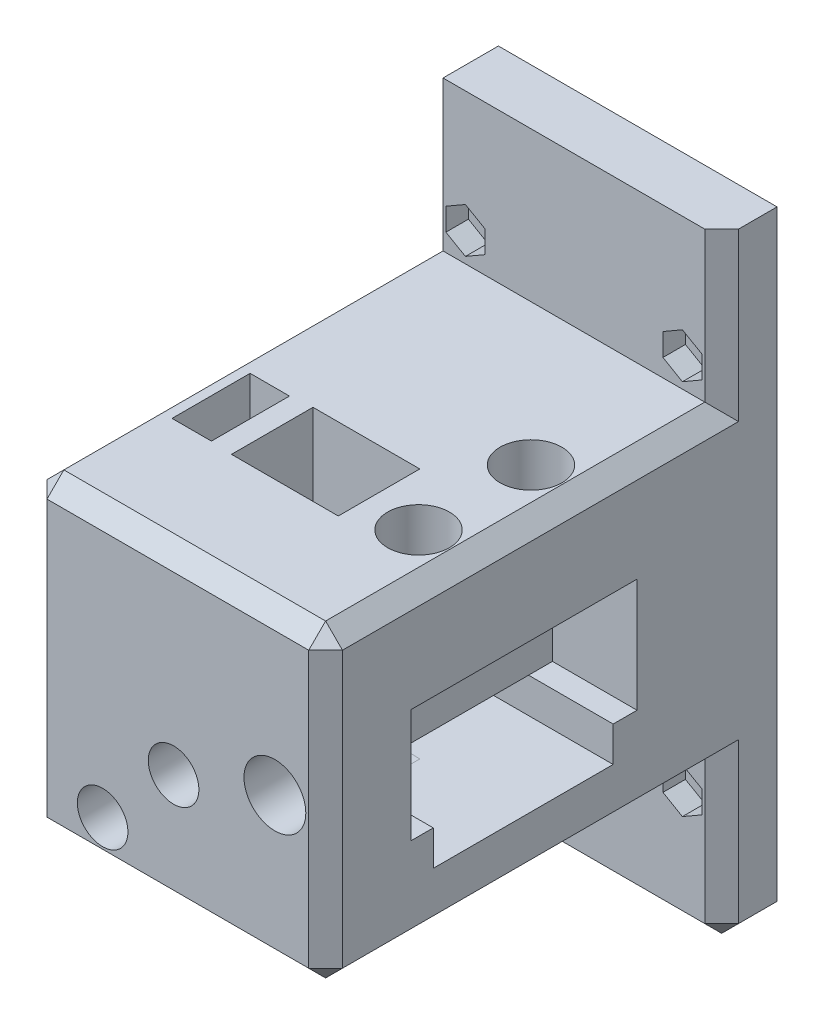
from build123d import *

# Parameters (mm, degrees)
SKETCH1_W                = 34.3
SKETCH1_H                = 70.3
SKETCH1_W_2              = 110
SKETCH1_H_2              = 9.85
BOSS_EXTRUDE1_DEPTH      = 15.048264774
BOSS_EXTRUDE3_DEPTH      = 10
BOSS_EXTRUDE4_DEPTH      = 27.518264774
CUT_EXTRUDE1_DEPTH       = 97.82308708
CUT_EXTRUDE1_DEPTH_BACK  = 97.82308708
SKETCH4_R                = 2
CUT_EXTRUDE3_DEPTH       = 77.2053469
CUT_EXTRUDE3_DEPTH_BACK  = 77.2053469
SKETCH8_W                = 129.903835659
SKETCH8_H                = 83.627886417
SKETCH9_W                = 44.357950904
SKETCH9_H                = 70.607950904
SKETCH9_W_2              = 20
SKETCH9_H_2              = 40
BOSS_EXTRUDE5_DEPTH      = 15.048264774
SKETCH10_W               = 20.2
SKETCH10_H               = 40.2
SKETCH10_W_2             = 20
SKETCH10_H_2             = 40
CUT_EXTRUDE6_DEPTH       = 81.359319258
SKETCH11_R               = 3
CUT_EXTRUDE7_DEPTH       = 30
CUT_EXTRUDE8_DEPTH       = 105.313703151
CUT_EXTRUDE8_DEPTH_BACK  = 8
SKETCH12_R               = 5.5
CUT_EXTRUDE10_DEPTH      = 81.359319258
CUT_EXTRUDE10_DEPTH_BACK = 81.359319258
SKETCH14_W               = 7.032197939
SKETCH14_H               = 32
SKETCH19_W               = 44.357950904
SKETCH19_H               = 70.453975452
BOSS_EXTRUDE9_DEPTH      = 3
BOSS_EXTRUDE6_DEPTH      = 19.3
SKETCH16_R               = 3.4
BOSS_EXTRUDE7_DEPTH      = 2.1
BOSS_EXTRUDE8_DEPTH      = 16.35
SKETCH20_R               = 3.4
BOSS_EXTRUDE10_DEPTH     = 0.5
SKETCH21_W               = 18.048264774
SKETCH21_H               = 5.321024548
BOSS_EXTRUDE11_DEPTH     = 14.5
BOSS_EXTRUDE12_START     = 0.5
SKETCH24_R               = 3.4
BOSS_EXTRUDE12_DEPTH     = 0.5
CUT_EXTRUDE11_START      = -0.25
SKETCH25_R               = 3.4
CUT_EXTRUDE11_DEPTH      = 0.25
SKETCH26_R               = 3.4
BOSS_EXTRUDE13_DEPTH     = 1
BOSS_EXTRUDE14_DEPTH     = 20.303975452
CUT_EXTRUDE12_DEPTH      = 4
SKETCH29_R               = 5.5
CUT_EXTRUDE13_DEPTH      = 8
SKETCH30_R               = 3
CUT_EXTRUDE14_DEPTH      = 26
CUT_EXTRUDE15_DEPTH      = 626.267941866
CUT_EXTRUDE15_DEPTH_BACK = 626.267941866
SKETCH31_W               = 192.459482296
SKETCH31_H               = 197.325031006
SKETCH31_W_2             = 7.003218593
SKETCH31_H_2             = 13.886852379
CUT_EXTRUDE16_DEPTH      = 626.668982681
CUT_EXTRUDE16_DEPTH_BACK = 626.668982681
SKETCH32_R               = 2.5
CUT_EXTRUDE17_DEPTH      = 626.668982681
CUT_EXTRUDE17_DEPTH_BACK = 16
SKETCH33_R               = 4.5
SKETCH34_R               = 4.5
CUT_EXTRUDE18_DEPTH      = 12
CUT_EXTRUDE19_DEPTH      = 20
CUT_EXTRUDE20_DEPTH      = 13


with BuildPart() as part:
    # Sketch1 → Boss-Extrude1 (new body)
    # profile 1 of 2: a face of its own
    with BuildSketch(Plane.YZ):
        Rectangle(SKETCH1_W, SKETCH1_H)
        with BuildLine():
            Line((-10.15, 6.7), (-10.15, -6.7))
            ThreePointArc((-10.15, -6.7), (-9.871751442, -7.371751442), (-9.2, -7.65))
            Line((-9.2, -7.65), (-8.5, -7.65))
            ThreePointArc((-8.5, -7.65), (-8.181801948, -7.518198052), (-8.05, -7.2))
            Line((-8.05, -7.2), (-8.05, -5.094911614))
            ThreePointArc((-8.05, -5.094911614), (-7.621019548, -4.452896997), (-6.863711672, -4.603534899))
            Line((-6.863711672, -4.603534899), (-4.684745674, -6.782500897))
            ThreePointArc((-4.684745674, -6.782500897), (-4.066943332, -7.707107441), (-3.85, -8.797755224))
            Line((-3.85, -8.797755224), (-3.85, -11.202244776))
            ThreePointArc((-3.85, -11.202244776), (-4.066943332, -12.292892559), (-4.684745674, -13.217499103))
            Line((-4.684745674, -13.217499103), (-6.863711672, -15.396465101))
            ThreePointArc((-6.863711672, -15.396465101), (-7.621019548, -15.547103003), (-8.05, -14.905088386))
            Line((-8.05, -14.905088386), (-8.05, -12.8))
            ThreePointArc((-8.05, -12.8), (-8.181801948, -12.481801948), (-8.5, -12.35))
            Line((-8.5, -12.35), (-9.2, -12.35))
            ThreePointArc((-9.2, -12.35), (-9.871751442, -12.628248558), (-10.15, -13.3))
            Line((-10.15, -13.3), (-10.15, -18))
            ThreePointArc((-10.15, -18), (-9.52027958, -19.52027958), (-8, -20.15))
            Line((-8, -20.15), (-3.3, -20.15))
            ThreePointArc((-3.3, -20.15), (-2.628248558, -19.871751442), (-2.35, -19.2))
            Line((-2.35, -19.2), (-2.35, -18.5))
            ThreePointArc((-2.35, -18.5), (-2.481801948, -18.181801948), (-2.8, -18.05))
            Line((-2.8, -18.05), (-4.905088386, -18.05))
            ThreePointArc((-4.905088386, -18.05), (-5.547103003, -17.621019548), (-5.396465101, -16.863711672))
            Line((-5.396465101, -16.863711672), (-3.217499103, -14.684745674))
            ThreePointArc((-3.217499103, -14.684745674), (-2.292892559, -14.066943332), (-1.202244776, -13.85))
            Line((-1.202244776, -13.85), (1.202244776, -13.85))
            ThreePointArc((1.202244776, -13.85), (2.292892559, -14.066943332), (3.217499103, -14.684745674))
            Line((3.217499103, -14.684745674), (5.396465101, -16.863711672))
            ThreePointArc((5.396465101, -16.863711672), (5.547103003, -17.621019548), (4.905088386, -18.05))
            Line((4.905088386, -18.05), (2.8, -18.05))
            ThreePointArc((2.8, -18.05), (2.481801948, -18.181801948), (2.35, -18.5))
            Line((2.35, -18.5), (2.35, -19.2))
            ThreePointArc((2.35, -19.2), (2.628248558, -19.871751442), (3.3, -20.15))
            Line((3.3, -20.15), (8, -20.15))
            ThreePointArc((8, -20.15), (9.52027958, -19.52027958), (10.15, -18))
            Line((10.15, -18), (10.15, -13.3))
            ThreePointArc((10.15, -13.3), (9.871751442, -12.628248558), (9.2, -12.35))
            Line((9.2, -12.35), (8.5, -12.35))
            ThreePointArc((8.5, -12.35), (8.181801948, -12.481801948), (8.05, -12.8))
            Line((8.05, -12.8), (8.05, -14.905088386))
            ThreePointArc((8.05, -14.905088386), (7.621019548, -15.547103003), (6.863711672, -15.396465101))
            Line((6.863711672, -15.396465101), (4.684745674, -13.217499103))
            ThreePointArc((4.684745674, -13.217499103), (4.066943332, -12.292892559), (3.85, -11.202244776))
            Line((3.85, -11.202244776), (3.85, -8.797755224))
            ThreePointArc((3.85, -8.797755224), (4.066943332, -7.707107441), (4.684745674, -6.782500897))
            Line((4.684745674, -6.782500897), (6.863711672, -4.603534899))
            ThreePointArc((6.863711672, -4.603534899), (7.621019548, -4.452896997), (8.05, -5.094911614))
            Line((8.05, -5.094911614), (8.05, -7.2))
            ThreePointArc((8.05, -7.2), (8.181801948, -7.518198052), (8.5, -7.65))
            Line((8.5, -7.65), (9.2, -7.65))
            ThreePointArc((9.2, -7.65), (9.871751442, -7.371751442), (10.15, -6.7))
            Line((10.15, -6.7), (10.15, 6.7))
            ThreePointArc((10.15, 6.7), (9.871751442, 7.371751442), (9.2, 7.65))
            Line((9.2, 7.65), (8.5, 7.65))
            ThreePointArc((8.5, 7.65), (8.181801948, 7.518198052), (8.05, 7.2))
            Line((8.05, 7.2), (8.05, 5.094911614))
            ThreePointArc((8.05, 5.094911614), (7.621019548, 4.452896997), (6.863711672, 4.603534899))
            Line((6.863711672, 4.603534899), (4.684745674, 6.782500897))
            ThreePointArc((4.684745674, 6.782500897), (4.066943332, 7.707107441), (3.85, 8.797755224))
            Line((3.85, 8.797755224), (3.85, 11.202244776))
            ThreePointArc((3.85, 11.202244776), (4.066943332, 12.292892559), (4.684745674, 13.217499103))
            Line((4.684745674, 13.217499103), (6.863711672, 15.396465101))
            ThreePointArc((6.863711672, 15.396465101), (7.621019548, 15.547103003), (8.05, 14.905088386))
            Line((8.05, 14.905088386), (8.05, 12.8))
            ThreePointArc((8.05, 12.8), (8.181801948, 12.481801948), (8.5, 12.35))
            Line((8.5, 12.35), (9.2, 12.35))
            ThreePointArc((9.2, 12.35), (9.871751442, 12.628248558), (10.15, 13.3))
            Line((10.15, 13.3), (10.15, 18))
            ThreePointArc((10.15, 18), (9.52027958, 19.52027958), (8, 20.15))
            Line((8, 20.15), (3.3, 20.15))
            ThreePointArc((3.3, 20.15), (2.628248558, 19.871751442), (2.35, 19.2))
            Line((2.35, 19.2), (2.35, 18.5))
            ThreePointArc((2.35, 18.5), (2.481801948, 18.181801948), (2.8, 18.05))
            Line((2.8, 18.05), (4.905088386, 18.05))
            ThreePointArc((4.905088386, 18.05), (5.547103003, 17.621019548), (5.396465101, 16.863711672))
            Line((5.396465101, 16.863711672), (3.217499103, 14.684745674))
            ThreePointArc((3.217499103, 14.684745674), (2.292892559, 14.066943332), (1.202244776, 13.85))
            Line((1.202244776, 13.85), (-1.202244776, 13.85))
            ThreePointArc((-1.202244776, 13.85), (-2.292892559, 14.066943332), (-3.217499103, 14.684745674))
            Line((-3.217499103, 14.684745674), (-5.396465101, 16.863711672))
            ThreePointArc((-5.396465101, 16.863711672), (-5.547103003, 17.621019548), (-4.905088386, 18.05))
            Line((-4.905088386, 18.05), (-2.8, 18.05))
            ThreePointArc((-2.8, 18.05), (-2.481801948, 18.181801948), (-2.35, 18.5))
            Line((-2.35, 18.5), (-2.35, 19.2))
            ThreePointArc((-2.35, 19.2), (-2.628248558, 19.871751442), (-3.3, 20.15))
            Line((-3.3, 20.15), (-8, 20.15))
            ThreePointArc((-8, 20.15), (-9.52027958, 19.52027958), (-10.15, 18))
            Line((-10.15, 18), (-10.15, 13.3))
            ThreePointArc((-10.15, 13.3), (-9.871751442, 12.628248558), (-9.2, 12.35))
            Line((-9.2, 12.35), (-8.5, 12.35))
            ThreePointArc((-8.5, 12.35), (-8.181801948, 12.481801948), (-8.05, 12.8))
            Line((-8.05, 12.8), (-8.05, 14.905088386))
            ThreePointArc((-8.05, 14.905088386), (-7.621019548, 15.547103003), (-6.863711672, 15.396465101))
            Line((-6.863711672, 15.396465101), (-4.684745674, 13.217499103))
            ThreePointArc((-4.684745674, 13.217499103), (-4.066943332, 12.292892559), (-3.85, 11.202244776))
            Line((-3.85, 11.202244776), (-3.85, 8.797755224))
            ThreePointArc((-3.85, 8.797755224), (-4.066943332, 7.707107441), (-4.684745674, 6.782500897))
            Line((-4.684745674, 6.782500897), (-6.863711672, 4.603534899))
            ThreePointArc((-6.863711672, 4.603534899), (-7.621019548, 4.452896997), (-8.05, 5.094911614))
            Line((-8.05, 5.094911614), (-8.05, 7.2))
            ThreePointArc((-8.05, 7.2), (-8.181801948, 7.518198052), (-8.5, 7.65))
            Line((-8.5, 7.65), (-9.2, 7.65))
            ThreePointArc((-9.2, 7.65), (-9.871751442, 7.371751442), (-10.15, 6.7))
        make_face(mode=Mode.SUBTRACT)
    # profile 2 of 2: a face of its own
    with BuildSketch(Plane.YZ):
        with Locations((0, -40.075)):
            Rectangle(SKETCH1_W_2, SKETCH1_H_2)
    extrude(amount=-BOSS_EXTRUDE1_DEPTH)

    # Sketch2 → Boss-Extrude3 (add)
    with BuildSketch(Plane.YZ):
        Polygon((17.15, 35.15), (-17.15, 35.15), (-17.15, -35.15), (-55, -35.15), (-55, -45), (55, -45), (55, -35.15), (17.15, -35.15), align=None)
    extrude(amount=BOSS_EXTRUDE3_DEPTH)

    # Sketch3 → Boss-Extrude4 (add)
    with BuildSketch(Plane.YZ.offset(10)):
        Polygon((-17.15, -35.15), (17.15, -35.15), (55, -35.15), (55, -45), (-55, -45), (-55, -35.15), align=None)
    extrude(amount=BOSS_EXTRUDE4_DEPTH)

    # Sketch4 → Cut-Extrude1 (cut, two sides: drawn at the far end of the back side and taken through both)
    with BuildSketch(Plane.XY.offset(-35.15).offset(-CUT_EXTRUDE1_DEPTH_BACK)):
        with Locations((-8.06818722, 33.5)):
            Circle(SKETCH4_R)
        with Locations((-8.06818722, -33.5)):
            Circle(SKETCH4_R)
        with Locations((30.53818722, -33.5)):
            Circle(SKETCH4_R)
        with Locations((30.53818722, 33.5)):
            Circle(SKETCH4_R)
    extrude(amount=CUT_EXTRUDE1_DEPTH + CUT_EXTRUDE1_DEPTH_BACK, mode=Mode.SUBTRACT)

    # Sketch8 → Cut-Extrude3 (cut, two sides: drawn at the far end of the back side and taken through both)
    with BuildSketch(Plane.YZ.offset(10).offset(-CUT_EXTRUDE3_DEPTH_BACK)):
        with Locations((-9.95191783, 6.663943208)):
            Rectangle(SKETCH8_W, SKETCH8_H)
    extrude(amount=CUT_EXTRUDE3_DEPTH + CUT_EXTRUDE3_DEPTH_BACK, mode=Mode.SUBTRACT)

    # Sketch9 → Boss-Extrude5 (add)
    with BuildSketch(Plane(origin=(-15.048264774, 0, 0), x_dir=(0, -1, 0), z_dir=(-1, 0, 0))):
        with Locations((-0.848975452, 0)):
            Rectangle(SKETCH9_W, SKETCH9_H)
        Rectangle(SKETCH9_W_2, SKETCH9_H_2, mode=Mode.SUBTRACT)
    extrude(amount=-BOSS_EXTRUDE5_DEPTH)

    # Sketch10 → Cut-Extrude6 (cut, through all)
    with BuildSketch(Plane.YZ):
        Rectangle(SKETCH10_W, SKETCH10_H)
        Rectangle(SKETCH10_W_2, SKETCH10_H_2, mode=Mode.SUBTRACT)
    extrude(amount=-CUT_EXTRUDE6_DEPTH, mode=Mode.SUBTRACT)

    # Sketch11 → Cut-Extrude7 (cut)
    with BuildSketch(Plane.XY.offset(35.303975452)):
        with Locations((-6.024132387, 0)):
            Circle(SKETCH11_R)
    extrude(amount=-CUT_EXTRUDE7_DEPTH, mode=Mode.SUBTRACT)

    # Sketch12 → Cut-Extrude8 (cut, two sides: drawn at the far end of the back side and taken through both)
    with BuildSketch(Plane.XY.offset(35.303975452).offset(-CUT_EXTRUDE8_DEPTH_BACK)):
        with Locations((-6.024132387, 0)):
            Circle(SKETCH12_R)
    extrude(amount=CUT_EXTRUDE8_DEPTH + CUT_EXTRUDE8_DEPTH_BACK, mode=Mode.SUBTRACT)

    # Sketch14 → Cut-Extrude10 (cut, two sides: drawn at the far end of the back side and taken through both)
    with BuildSketch(Plane.YZ.offset(-CUT_EXTRUDE10_DEPTH_BACK)):
        with Locations((-12.813901031, 0.15)):
            Rectangle(SKETCH14_W, SKETCH14_H)
    extrude(amount=CUT_EXTRUDE10_DEPTH + CUT_EXTRUDE10_DEPTH_BACK, mode=Mode.SUBTRACT)

    # Sketch19 → Boss-Extrude9 (add)
    # profile 1 of 2: a face of its own
    with BuildSketch(Plane.YZ):
        with Locations((0.848975452, 0.076987726)):
            Rectangle(SKETCH19_W, SKETCH19_H)
        Polygon((-16.33, -15.85), (-16.33, 16.15), (-10.1, 16.15), (-10.1, 20.1), (10.1, 20.1), (10.1, -20.1), (-10.1, -20.1), (-10.1, -15.85), align=None, mode=Mode.SUBTRACT)
    # profile 2 of 2: a face of its own
    with BuildSketch(Plane.YZ):
        Polygon((-10.1, 16.15), (-10.1, -15.85), (-10.1, -20.1), (10.1, -20.1), (10.1, 20.1), (-10.1, 20.1), align=None)
    extrude(amount=BOSS_EXTRUDE9_DEPTH)

    # Sketch15 → Boss-Extrude6 (add)
    with BuildSketch(Plane.XY.offset(-35.15)):
        Polygon((37.518264774, 28.348975452), (-15.048264774, 28.348975452), (-15.048264774, 23.027950904), (3, 23.027950904), (3, -21.33), (-15.048264774, -21.33), (-15.048264774, -26.651024548), (37.518264774, -26.651024548), align=None)
    extrude(amount=BOSS_EXTRUDE6_DEPTH)

    # Sketch16 → Boss-Extrude7 (add)
    with BuildSketch(Plane.XY.offset(-15.85)):
        with Locations(Location((24.73, -18.73, 0), (0, 0, 180))):
            Circle(SKETCH16_R)
    extrude(amount=BOSS_EXTRUDE7_DEPTH)

    # Sketch18 → Boss-Extrude8 (add)
    with BuildSketch(Plane.XY.offset(-15.85)):
        Polygon((14.73, -16.33), (3, -16.33), (3, -21.33), (-15.048264774, -21.33), (-15.048264774, -26.651024548), (14.73, -26.651024548), (14.73, -18.73), align=None)
        with BuildLine():
            Line((3, 23.027950904), (3, -10.1))
            Line((3, -10.1), (24.091429665, -8.750409431))
            ThreePointArc((24.091429665, -8.750409431), (31.571574988, -11.43665703), (34.73, -18.73))
            Line((34.73, -18.73), (34.73, -26.651024548))
            Line((34.73, -26.651024548), (37.518264774, -26.651024548))
            Line((37.518264774, -26.651024548), (37.518264774, 28.348975452))
            Line((37.518264774, 28.348975452), (-15.048264774, 28.348975452))
            Line((-15.048264774, 28.348975452), (-15.048264774, 23.027950904))
            Line((-15.048264774, 23.027950904), (3, 23.027950904))
        make_face()
    extrude(amount=BOSS_EXTRUDE8_DEPTH)

    # Sketch20 → Boss-Extrude10 (add)
    with BuildSketch(Plane.XY.offset(0.5)):
        with Locations((12, -6)):
            Circle(SKETCH20_R)
    extrude(amount=BOSS_EXTRUDE10_DEPTH)

    # Sketch21 → Boss-Extrude11 (add)
    with BuildSketch(Plane.XY.offset(0.5)):
        with BuildLine():
            Line((22, 28.348975452), (22, -6))
            ThreePointArc((22, -6), (19.071067812, -13.071067812), (12, -16))
            Line((12, -16), (3, -16.33))
            Line((3, -16.33), (3, -21.33))
            Line((3, -21.33), (-15.048264774, -21.33))
            Line((-15.048264774, -21.33), (-15.048264774, -26.651024548))
            Line((-15.048264774, -26.651024548), (37.518264774, -26.651024548))
            Line((37.518264774, -26.651024548), (37.518264774, 28.348975452))
            Line((37.518264774, 28.348975452), (22, 28.348975452))
        make_face()
        with Locations((-6.024132387, 25.688463178)):
            Rectangle(SKETCH21_W, SKETCH21_H)
    extrude(amount=BOSS_EXTRUDE11_DEPTH)

    # Sketch24 → Boss-Extrude12 (add)
    with BuildSketch(Plane.YX.offset(-0.5).offset(BOSS_EXTRUDE12_START)):
        with Locations(Location((-18.73, 24.73, 0), (0, 0, 270))):
            Circle(SKETCH24_R)
    extrude(amount=-BOSS_EXTRUDE12_DEPTH)

    # Sketch25 → Cut-Extrude11 (cut)
    with BuildSketch(Plane.XY.offset(-13.75).offset(CUT_EXTRUDE11_START)):
        with Locations(Location((24.73, -18.73, 0), (0, 0, 180))):
            Circle(SKETCH25_R)
    extrude(amount=CUT_EXTRUDE11_DEPTH, mode=Mode.SUBTRACT)



with BuildPart() as body_2:
    # Sketch26 → Boss-Extrude13 (new body)
    with BuildSketch(Plane(origin=(0, 0, 14), x_dir=(0, -1, 0), z_dir=(0, 0, 1))):
        with Locations(Location((6, 12, 0), (0, 0, 90))):
            Circle(SKETCH26_R)
    extrude(amount=BOSS_EXTRUDE13_DEPTH)


with BuildPart() as part_1:
    add(part.part)

    add(body_2.part)  # Boss-Extrude14 merges body 2
    # Sketch27 → Boss-Extrude14 (add)
    with BuildSketch(Plane.XY.offset(15)):
        with BuildLine():
            Line((3, -16.33), (3, -21.33))
            Line((3, -21.33), (-15.048264774, -21.33))
            Line((-15.048264774, -21.33), (-15.048264774, -26.651024548))
            Line((-15.048264774, -26.651024548), (37.518264774, -26.651024548))
            Line((37.518264774, -26.651024548), (37.518264774, 28.348975452))
            Line((37.518264774, 28.348975452), (22, 28.348975452))
            Line((22, 28.348975452), (22, -6))
            ThreePointArc((22, -6), (19.071067812, -13.071067812), (12, -16))
            Line((12, -16), (3, -16.33))
        make_face()
        with BuildLine():
            Line((-15.048264774, 28.348975452), (-15.048264774, 23.027950904))
            Line((-15.048264774, 23.027950904), (3, 23.027950904))
            Line((3, 23.027950904), (3, -16.33))
            Line((3, -16.33), (12, -16))
            ThreePointArc((12, -16), (19.071067812, -13.071067812), (22, -6))
            Line((22, -6), (22, 28.348975452))
            Line((22, 28.348975452), (-15.048264774, 28.348975452))
        make_face()
    extrude(amount=BOSS_EXTRUDE14_DEPTH)

    # Chamfer1
    # the kernel refuses this chamfer: 3 mm, written as the material it takes off along each edge
    with BuildSketch(Plane(origin=(-13.048264774, 26.348975452, 33.303975452), x_dir=(0.7071067812061043, 0.7071067811669909, 0), z_dir=(-0.5773502691639131, 0.577350269195849, 0.5773502692091153)), Plane(origin=(35.518264774, 26.348975452, 33.303975452), x_dir=(0.707106781206494, -0.707106781166601, 0), z_dir=(0.5773502691634868, 0.5773502691960591, 0.5773502692093315)), Plane(origin=(-13.048264774, -24.651024548, 33.303975452), x_dir=(0.707106781214228, 0, 0.7071067811588669), z_dir=(-0.5773502691639134, -0.5773502691958485, 0.5773502692091155))) as chamfer1_piece_1:
        Polygon((-2.121320344, 1.224744871), (2.121320344, 1.224744871), (0, -2.449489743), align=None)
    extrude(amount=3.810511777, mode=Mode.SUBTRACT)
    with BuildSketch(Plane(origin=(35.518264774, -24.651024548, 33.303975452), x_dir=(-0.7071067812146217, 0, 0.7071067811584735), z_dir=(0.5773502691634872, -0.5773502691960583, 0.577350269209332)), Plane(origin=(-13.048264774, -53, -37.15), x_dir=(0.7071067811865476, -0.7071067811865476, 0), z_dir=(-0.5773502691896262, -0.5773502691896262, 0.5773502691896248)), Plane(origin=(35.518264774, -53, -37.15), x_dir=(0, -0.7071067811865467, -0.7071067811865483), z_dir=(0.5773502691896262, -0.5773502691896262, 0.5773502691896248))) as chamfer1_piece_2:
        Polygon((-2.121320344, -1.224744871), (2.121320344, -1.224744871), (0, 2.449489743), align=None)
    extrude(amount=3.810511777, mode=Mode.SUBTRACT)
    with BuildSketch(Plane(origin=(-15.048264774, 28.348975452, -35.15), x_dir=(-0.02749587661058619, 0, -0.9996219169112968), z_dir=(0, 1, 0))) as chamfer1_piece_3:
        with BuildLine():
            Line((3.086019586, 0), (-0.169641465, -3.081353381))
            Line((-0.169641465, -3.081353381), (-0.22961878, -3.079703628))
            ThreePointArc((-0.22961878, -3.079703628), (-0.102387681, -1.540193489), (-0.059977315, 0.001649753))
            Line((-0.059977315, 0.001649753), (0.001649753, 0.059977315))
            ThreePointArc((0.001649753, 0.059977315), (1.543492994, 0.017566949), (3.087669338, 0.059977315))
            Line((3.087669338, 0.059977315), (3.086019586, 0))
        make_face()
    extrude(amount=34.366073512, mode=Mode.SUBTRACT)
    with BuildSketch(Plane(origin=(37.518264774, 28.348975452, -35.15), x_dir=(0.027495876610586768, 0, -0.9996219169112968), z_dir=(0, 1, 0))) as chamfer1_piece_4:
        with BuildLine():
            Line((3.086019586, 0), (-0.169641465, 3.081353381))
            Line((-0.169641465, 3.081353381), (-0.22961878, 3.079703628))
            ThreePointArc((-0.22961878, 3.079703628), (-0.102387681, 1.540193489), (-0.059977315, -0.001649753))
            Line((-0.059977315, -0.001649753), (0.001649753, -0.059977315))
            ThreePointArc((0.001649753, -0.059977315), (1.543492994, -0.017566949), (3.087669338, -0.059977315))
            Line((3.087669338, -0.059977315), (3.086019586, 0))
        make_face()
    extrude(amount=34.366073512, mode=Mode.SUBTRACT)
    with BuildSketch(Plane(origin=(-15.048264774, 28.348975452, 43.019024416), x_dir=(-0.02749587661058619, -0.9996219169112968, 0), z_dir=(0, 0, -1)), Plane(origin=(37.518264774, 28.348975452, -35.15), x_dir=(0.027495876666186494, -0.9996219169097673, 0), z_dir=(0, 0, 1)), Plane(origin=(37.518264774, -26.651024548, 43.019024416), x_dir=(0.027495876610586768, 0.9996219169112968, 0), z_dir=(0, 0, -1)), Plane(origin=(-15.048264774, -26.651024548, -35.15), x_dir=(-0.027495876665117977, 0.9996219169097968, 0), z_dir=(0, 0, 1))) as chamfer1_piece_5:
        with BuildLine():
            Line((3.086019586, 0), (-0.169641465, -3.081353381))
            Line((-0.169641465, -3.081353381), (-0.22961878, -3.079703628))
            ThreePointArc((-0.22961878, -3.079703628), (-0.102387681, -1.540193489), (-0.059977315, 0.001649753))
            Line((-0.059977315, 0.001649753), (0.001649753, 0.059977315))
            ThreePointArc((0.001649753, 0.059977315), (1.543492994, 0.017566949), (3.087669338, 0.059977315))
            Line((3.087669338, 0.059977315), (3.086019586, 0))
        make_face()
    extrude(amount=78.169024416, mode=Mode.SUBTRACT)
    with BuildSketch(Plane(origin=(-15.048264774, 23.027950904, 35.303975452), x_dir=(-0.027495876665116284, 0, -0.9996219169097968), z_dir=(0, -1, 0))) as chamfer1_piece_6:
        with BuildLine():
            Line((3.086019586, 0), (-0.169641465, 3.081353381))
            Line((-0.169641465, 3.081353381), (-0.22961878, 3.079703628))
            ThreePointArc((-0.22961878, 3.079703628), (-0.102387681, 1.540193489), (-0.059977315, -0.001649753))
            Line((-0.059977315, -0.001649753), (0.001649753, -0.059977315))
            ThreePointArc((0.001649753, -0.059977315), (1.543492994, -0.017566949), (3.087669338, -0.059977315))
            Line((3.087669338, -0.059977315), (3.086019586, 0))
        make_face()
    extrude(amount=44.357950904, mode=Mode.SUBTRACT)
    with BuildSketch(Plane(origin=(-22.763313738, -26.651024548, 35.303975452), x_dir=(0, 0.9996219169112965, 0.02749587661058676), z_dir=(1, 0, 0))) as chamfer1_piece_7:
        with BuildLine():
            Line((3.086019586, 0), (-0.169641465, -3.081353381))
            Line((-0.169641465, -3.081353381), (-0.22961878, -3.079703628))
            ThreePointArc((-0.22961878, -3.079703628), (-0.102387681, -1.540193489), (-0.059977315, 0.001649753))
            Line((-0.059977315, 0.001649753), (0.001649753, 0.059977315))
            ThreePointArc((0.001649753, 0.059977315), (1.543492994, 0.017566949), (3.087669338, 0.059977315))
            Line((3.087669338, 0.059977315), (3.086019586, 0))
        make_face()
    extrude(amount=67.996627475, mode=Mode.SUBTRACT)
    with BuildSketch(Plane(origin=(37.518264774, -34.366073512, 35.303975452), x_dir=(0.027495876610586768, 0, -0.9996219169112968), z_dir=(0, 1, 0))) as chamfer1_piece_8:
        with BuildLine():
            Line((3.086019586, 0), (-0.169641465, 3.081353381))
            Line((-0.169641465, 3.081353381), (-0.22961878, 3.079703628))
            ThreePointArc((-0.22961878, 3.079703628), (-0.102387681, 1.540193489), (-0.059977315, -0.001649753))
            Line((-0.059977315, -0.001649753), (0.001649753, -0.059977315))
            ThreePointArc((0.001649753, -0.059977315), (1.543492994, -0.017566949), (3.087669338, -0.059977315))
            Line((3.087669338, -0.059977315), (3.086019586, 0))
        make_face()
    extrude(amount=70.430097928, mode=Mode.SUBTRACT)
    with BuildSketch(Plane(origin=(45.233313738, 28.348975452, 35.303975452), x_dir=(0, 0.027495876610586768, -0.9996219169112968), z_dir=(-1, 0, 0))) as chamfer1_piece_9:
        with BuildLine():
            Line((3.086019586, 0), (-0.169641465, 3.081353381))
            Line((-0.169641465, 3.081353381), (-0.22961878, 3.079703628))
            ThreePointArc((-0.22961878, 3.079703628), (-0.102387681, 1.540193489), (-0.059977315, -0.001649753))
            Line((-0.059977315, -0.001649753), (0.001649753, -0.059977315))
            ThreePointArc((0.001649753, -0.059977315), (1.543492994, -0.017566949), (3.087669338, -0.059977315))
            Line((3.087669338, -0.059977315), (3.086019586, 0))
        make_face()
    extrude(amount=67.996627475, mode=Mode.SUBTRACT)
    with BuildSketch(Plane(origin=(-15.048264774, -62.715048964, -35.15), x_dir=(-0.02749587661058619, 0, -0.9996219169112968), z_dir=(0, 1, 0))) as chamfer1_piece_10:
        with BuildLine():
            Line((3.086019586, 0), (-0.169641465, -3.081353381))
            Line((-0.169641465, -3.081353381), (-0.22961878, -3.079703628))
            ThreePointArc((-0.22961878, -3.079703628), (-0.102387681, -1.540193489), (-0.059977315, 0.001649753))
            Line((-0.059977315, 0.001649753), (0.001649753, 0.059977315))
            ThreePointArc((0.001649753, 0.059977315), (1.543492994, 0.017566949), (3.087669338, 0.059977315))
            Line((3.087669338, 0.059977315), (3.086019586, 0))
        make_face()
    extrude(amount=36.064024416, mode=Mode.SUBTRACT)
    with BuildSketch(Plane(origin=(37.518264774, -62.715048964, -35.15), x_dir=(0.027495876610586768, 0, -0.9996219169112968), z_dir=(0, 1, 0))) as chamfer1_piece_11:
        with BuildLine():
            Line((3.086019586, 0), (-0.169641465, 3.081353381))
            Line((-0.169641465, 3.081353381), (-0.22961878, 3.079703628))
            ThreePointArc((-0.22961878, 3.079703628), (-0.102387681, 1.540193489), (-0.059977315, -0.001649753))
            Line((-0.059977315, -0.001649753), (0.001649753, -0.059977315))
            ThreePointArc((0.001649753, -0.059977315), (1.543492994, -0.017566949), (3.087669338, -0.059977315))
            Line((3.087669338, -0.059977315), (3.086019586, 0))
        make_face()
    extrude(amount=36.064024416, mode=Mode.SUBTRACT)
    with BuildSketch(Plane(origin=(-15.048264774, -55, -27.434951036), x_dir=(-0.02749587661058619, 0.9996219169112968, 0), z_dir=(0, 0, -1))) as chamfer1_piece_12:
        with BuildLine():
            Line((3.086019586, 0), (-0.169641465, 3.081353381))
            Line((-0.169641465, 3.081353381), (-0.22961878, 3.079703628))
            ThreePointArc((-0.22961878, 3.079703628), (-0.102387681, 1.540193489), (-0.059977315, -0.001649753))
            Line((-0.059977315, -0.001649753), (0.001649753, -0.059977315))
            ThreePointArc((0.001649753, -0.059977315), (1.543492994, -0.017566949), (3.087669338, -0.059977315))
            Line((3.087669338, -0.059977315), (3.086019586, 0))
        make_face()
    extrude(amount=25.280097928, mode=Mode.SUBTRACT)
    with BuildSketch(Plane(origin=(37.518264774, -55, -52.715048964), x_dir=(-0.9996219169112965, -0.02749587661058676, 0), z_dir=(0, 0, 1)), Plane(origin=(37.518264774, 55, -27.434951036), x_dir=(-0.9996219169112965, 0.02749587661058676, 0), z_dir=(0, 0, -1))) as chamfer1_piece_13:
        with BuildLine():
            Line((3.086019586, 0), (-0.169641465, -3.081353381))
            Line((-0.169641465, -3.081353381), (-0.22961878, -3.079703628))
            ThreePointArc((-0.22961878, -3.079703628), (-0.102387681, -1.540193489), (-0.059977315, 0.001649753))
            Line((-0.059977315, 0.001649753), (0.001649753, 0.059977315))
            ThreePointArc((0.001649753, 0.059977315), (1.543492994, 0.017566949), (3.087669338, 0.059977315))
            Line((3.087669338, 0.059977315), (3.086019586, 0))
        make_face()
    extrude(amount=25.280097928, mode=Mode.SUBTRACT)
    with BuildSketch(Plane(origin=(45.233313738, -55, -35.15), x_dir=(0, -0.027495876610586768, -0.9996219169112968), z_dir=(-1, 0, 0))) as chamfer1_piece_14:
        with BuildLine():
            Line((3.086019586, 0), (-0.169641465, -3.081353381))
            Line((-0.169641465, -3.081353381), (-0.22961878, -3.079703628))
            ThreePointArc((-0.22961878, -3.079703628), (-0.102387681, -1.540193489), (-0.059977315, 0.001649753))
            Line((-0.059977315, 0.001649753), (0.001649753, 0.059977315))
            ThreePointArc((0.001649753, 0.059977315), (1.543492994, 0.017566949), (3.087669338, 0.059977315))
            Line((3.087669338, 0.059977315), (3.086019586, 0))
        make_face()
    extrude(amount=67.996627476, mode=Mode.SUBTRACT)
    with BuildSketch(Plane(origin=(-15.048264774, 36.064024416, 35.303975452), x_dir=(-0.02749587661058619, 0, -0.9996219169112968), z_dir=(0, -1, 0)), Plane(origin=(-15.048264774, -21.33, 35.303975452), x_dir=(-0.02749587666542296, 0, -0.9996219169097883), z_dir=(0, -1, 0))) as chamfer1_piece_15:
        with BuildLine():
            Line((3.086019586, 0), (-0.169641465, 3.081353381))
            Line((-0.169641465, 3.081353381), (-0.22961878, 3.079703628))
            ThreePointArc((-0.22961878, 3.079703628), (-0.102387681, 1.540193489), (-0.059977315, -0.001649753))
            Line((-0.059977315, -0.001649753), (0.001649753, -0.059977315))
            ThreePointArc((0.001649753, -0.059977315), (1.543492994, -0.017566949), (3.087669338, -0.059977315))
            Line((3.087669338, -0.059977315), (3.086019586, 0))
        make_face()
    extrude(amount=13.036073512, mode=Mode.SUBTRACT)
    with BuildSketch(Plane(origin=(-15.048264774, 20.633926488, -35.15), x_dir=(-0.02749587661058619, 0, -0.9996219169112968), z_dir=(0, 1, 0))) as chamfer1_piece_16a_section:
        with BuildLine():
            Line((3.086019586, 0), (-0.169641465, -3.081353381))
            Line((-0.169641465, -3.081353381), (-0.22961878, -3.079703628))
            ThreePointArc((-0.22961878, -3.079703628), (-0.102387681, -1.540193489), (-0.059977315, 0.001649753))
            Line((-0.059977315, 0.001649753), (0.001649753, 0.059977315))
            ThreePointArc((0.001649753, 0.059977315), (1.543492994, 0.017566949), (3.087669338, 0.059977315))
            Line((3.087669338, 0.059977315), (3.086019586, 0))
        make_face()
    chamfer1_piece_16a = extrude(amount=42.081122476, mode=Mode.PRIVATE)
    chamfer1_piece_16a = split(chamfer1_piece_16a, bisect_by=Plane(origin=(-14.058883894, 28.348975452, -36.13938088), z_dir=(0, -1, 0)), keep=Keep.TOP, mode=Mode.PRIVATE)
    with BuildSketch(Plane(origin=(-15.048264774, 28.348975452, 43.019024416), x_dir=(-0.02749587661058619, -0.9996219169112968, 0), z_dir=(0, 0, -1))) as chamfer1_piece_16b_section:
        with BuildLine():
            Line((3.086019586, 0), (-0.169641465, -3.081353381))
            Line((-0.169641465, -3.081353381), (-0.22961878, -3.079703628))
            ThreePointArc((-0.22961878, -3.079703628), (-0.102387681, -1.540193489), (-0.059977315, 0.001649753))
            Line((-0.059977315, 0.001649753), (0.001649753, 0.059977315))
            ThreePointArc((0.001649753, 0.059977315), (1.543492994, 0.017566949), (3.087669338, 0.059977315))
            Line((3.087669338, 0.059977315), (3.086019586, 0))
        make_face()
    chamfer1_piece_16b = extrude(amount=85.88407338, mode=Mode.PRIVATE)
    chamfer1_piece_16b = split(chamfer1_piece_16b, bisect_by=Plane(origin=(-14.058883894, 27.359594572, -35.15), z_dir=(0, 0, -1)), keep=Keep.TOP, mode=Mode.PRIVATE)
    chamfer1_piece_16 = chamfer1_piece_16a & chamfer1_piece_16b
    add(chamfer1_piece_16, mode=Mode.SUBTRACT)
    with BuildSketch(Plane(origin=(37.518264774, 28.348975452, -42.865048964), x_dir=(0.027495876610586768, -0.9996219169112968, 0), z_dir=(0, 0, 1))) as chamfer1_piece_17a_section:
        with BuildLine():
            Line((3.086019586, 0), (-0.169641465, -3.081353381))
            Line((-0.169641465, -3.081353381), (-0.22961878, -3.079703628))
            ThreePointArc((-0.22961878, -3.079703628), (-0.102387681, -1.540193489), (-0.059977315, 0.001649753))
            Line((-0.059977315, 0.001649753), (0.001649753, 0.059977315))
            ThreePointArc((0.001649753, 0.059977315), (1.543492994, 0.017566949), (3.087669338, 0.059977315))
            Line((3.087669338, 0.059977315), (3.086019586, 0))
        make_face()
    chamfer1_piece_17a = extrude(amount=85.88407338, mode=Mode.PRIVATE)
    chamfer1_piece_17a = split(chamfer1_piece_17a, bisect_by=Plane(origin=(36.528883894, 27.359594572, -35.15), z_dir=(0, 0, -1)), keep=Keep.TOP, mode=Mode.PRIVATE)
    with BuildSketch(Plane(origin=(37.518264774, 20.633926488, -35.15), x_dir=(0.027495876610586768, 0, -0.9996219169112968), z_dir=(0, 1, 0))) as chamfer1_piece_17b_section:
        with BuildLine():
            Line((3.086019586, 0), (-0.169641465, 3.081353381))
            Line((-0.169641465, 3.081353381), (-0.22961878, 3.079703628))
            ThreePointArc((-0.22961878, 3.079703628), (-0.102387681, 1.540193489), (-0.059977315, -0.001649753))
            Line((-0.059977315, -0.001649753), (0.001649753, -0.059977315))
            ThreePointArc((0.001649753, -0.059977315), (1.543492994, -0.017566949), (3.087669338, -0.059977315))
            Line((3.087669338, -0.059977315), (3.086019586, 0))
        make_face()
    chamfer1_piece_17b = extrude(amount=42.081122476, mode=Mode.PRIVATE)
    chamfer1_piece_17b = split(chamfer1_piece_17b, bisect_by=Plane(origin=(36.528883894, 28.348975452, -36.13938088), z_dir=(0, -1, 0)), keep=Keep.TOP, mode=Mode.PRIVATE)
    chamfer1_piece_17 = chamfer1_piece_17a & chamfer1_piece_17b
    add(chamfer1_piece_17, mode=Mode.SUBTRACT)
    with BuildSketch(Plane(origin=(37.518264774, -62.715048964, -35.15), x_dir=(0.027495876610586768, 0, -0.9996219169112968), z_dir=(0, 1, 0))) as chamfer1_piece_18a_section:
        with BuildLine():
            Line((3.086019586, 0), (-0.169641465, 3.081353381))
            Line((-0.169641465, 3.081353381), (-0.22961878, 3.079703628))
            ThreePointArc((-0.22961878, 3.079703628), (-0.102387681, 1.540193489), (-0.059977315, -0.001649753))
            Line((-0.059977315, -0.001649753), (0.001649753, -0.059977315))
            ThreePointArc((0.001649753, -0.059977315), (1.543492994, -0.017566949), (3.087669338, -0.059977315))
            Line((3.087669338, -0.059977315), (3.086019586, 0))
        make_face()
    chamfer1_piece_18a = extrude(amount=43.77907338, mode=Mode.PRIVATE)
    chamfer1_piece_18a = split(chamfer1_piece_18a, bisect_by=Plane(origin=(36.528883894, -26.651024548, -36.13938088), z_dir=(0, 1, 0)), keep=Keep.TOP, mode=Mode.PRIVATE)
    with BuildSketch(Plane(origin=(37.518264774, -26.651024548, 43.019024416), x_dir=(0.027495876610586768, 0.9996219169112968, 0), z_dir=(0, 0, -1))) as chamfer1_piece_18b_section:
        with BuildLine():
            Line((3.086019586, 0), (-0.169641465, -3.081353381))
            Line((-0.169641465, -3.081353381), (-0.22961878, -3.079703628))
            ThreePointArc((-0.22961878, -3.079703628), (-0.102387681, -1.540193489), (-0.059977315, 0.001649753))
            Line((-0.059977315, 0.001649753), (0.001649753, 0.059977315))
            ThreePointArc((0.001649753, 0.059977315), (1.543492994, 0.017566949), (3.087669338, 0.059977315))
            Line((3.087669338, 0.059977315), (3.086019586, 0))
        make_face()
    chamfer1_piece_18b = extrude(amount=85.88407338, mode=Mode.PRIVATE)
    chamfer1_piece_18b = split(chamfer1_piece_18b, bisect_by=Plane(origin=(36.528883894, -25.661643668, -35.15), z_dir=(0, 0, -1)), keep=Keep.TOP, mode=Mode.PRIVATE)
    chamfer1_piece_18 = chamfer1_piece_18a & chamfer1_piece_18b
    add(chamfer1_piece_18, mode=Mode.SUBTRACT)
    with BuildSketch(Plane(origin=(-15.048264774, -62.715048964, -35.15), x_dir=(-0.02749587661058619, 0, -0.9996219169112968), z_dir=(0, 1, 0))) as chamfer1_piece_19a_section:
        with BuildLine():
            Line((3.086019586, 0), (-0.169641465, -3.081353381))
            Line((-0.169641465, -3.081353381), (-0.22961878, -3.079703628))
            ThreePointArc((-0.22961878, -3.079703628), (-0.102387681, -1.540193489), (-0.059977315, 0.001649753))
            Line((-0.059977315, 0.001649753), (0.001649753, 0.059977315))
            ThreePointArc((0.001649753, 0.059977315), (1.543492994, 0.017566949), (3.087669338, 0.059977315))
            Line((3.087669338, 0.059977315), (3.086019586, 0))
        make_face()
    chamfer1_piece_19a = extrude(amount=43.77907338, mode=Mode.PRIVATE)
    chamfer1_piece_19a = split(chamfer1_piece_19a, bisect_by=Plane(origin=(-14.058883894, -26.651024548, -36.13938088), z_dir=(0, 1, 0)), keep=Keep.TOP, mode=Mode.PRIVATE)
    with BuildSketch(Plane(origin=(-15.048264774, -26.651024548, -42.865048964), x_dir=(-0.02749587661058619, 0.9996219169112968, 0), z_dir=(0, 0, 1))) as chamfer1_piece_19b_section:
        with BuildLine():
            Line((3.086019586, 0), (-0.169641465, -3.081353381))
            Line((-0.169641465, -3.081353381), (-0.22961878, -3.079703628))
            ThreePointArc((-0.22961878, -3.079703628), (-0.102387681, -1.540193489), (-0.059977315, 0.001649753))
            Line((-0.059977315, 0.001649753), (0.001649753, 0.059977315))
            ThreePointArc((0.001649753, 0.059977315), (1.543492994, 0.017566949), (3.087669338, 0.059977315))
            Line((3.087669338, 0.059977315), (3.086019586, 0))
        make_face()
    chamfer1_piece_19b = extrude(amount=85.88407338, mode=Mode.PRIVATE)
    chamfer1_piece_19b = split(chamfer1_piece_19b, bisect_by=Plane(origin=(-14.058883894, -25.661643668, -35.15), z_dir=(0, 0, -1)), keep=Keep.TOP, mode=Mode.PRIVATE)
    chamfer1_piece_19 = chamfer1_piece_19a & chamfer1_piece_19b
    add(chamfer1_piece_19, mode=Mode.SUBTRACT)

    # Sketch28 → Cut-Extrude12 (cut)
    with BuildSketch(Plane.XY.offset(-35.15)):
        Polygon((-8.06818722, -37.5), (-4.604085605, -35.5), (-4.604085605, -31.5), (-8.06818722, -29.5), (-11.532288835, -31.5), (-11.532288835, -35.5), align=None)
        Polygon((34.002288835, -31.5), (30.53818722, -29.5), (27.074085604, -31.5), (27.074085604, -35.5), (30.53818722, -37.5), (34.002288835, -35.5), align=None)
        Polygon((-4.604085605, 31.5), (-4.604085605, 35.5), (-8.06818722, 37.5), (-11.532288835, 35.5), (-11.532288835, 31.5), (-8.06818722, 29.5), align=None)
        Polygon((34.002288835, 35.5), (30.53818722, 37.5), (27.074085604, 35.5), (27.074085604, 31.5), (30.53818722, 29.5), (34.002288835, 31.5), align=None)
    extrude(amount=-CUT_EXTRUDE12_DEPTH, mode=Mode.SUBTRACT)

    # Sketch29 → Cut-Extrude13 (cut)
    with BuildSketch(Plane(origin=(0, 28.348975452, 0), x_dir=(-1, 0, 0), z_dir=(0, 1, 0))):
        with Locations(Location((6.274132387, 10, 0), (0, 0, 90))):
            Circle(SKETCH29_R)
        with Locations(Location((6.274132387, -10, 0), (0, 0, 90))):
            Circle(SKETCH29_R)
    extrude(amount=-CUT_EXTRUDE13_DEPTH, mode=Mode.SUBTRACT)

    # Sketch30 → Cut-Extrude14 (cut)
    with BuildSketch(Plane(origin=(0, 20.348975452, 0), x_dir=(-1, 0, 0), z_dir=(0, 1, 0))):
        with Locations(Location((6.274132387, 10, 0), (0, 0, 90))):
            Circle(SKETCH30_R)
        with Locations(Location((6.274132387, -10, 0), (0, 0, 90))):
            Circle(SKETCH30_R)
    extrude(amount=-CUT_EXTRUDE14_DEPTH, mode=Mode.SUBTRACT)


with BuildPart() as body_2_2:
    # Mirror2: mirrored copy
    add(part_1.part.mirror(Plane(origin=(-290.266735226, 0, 0), x_dir=(0, 0, 1), z_dir=(1, 0, 0))))


with BuildPart() as cut_extrude15_tool:
    # Sketch31 → Cut-Extrude15 (new, two sides: drawn at the far end of the back side and taken through both)
    with BuildSketch(Plane(origin=(0, 28.348975452, 0), x_dir=(-1, 0, 0), z_dir=(0, 1, 0)).offset(-CUT_EXTRUDE15_DEPTH_BACK)):
        with Locations((-34.459800215, -31.230096754)):
            Rectangle(SKETCH31_W, SKETCH31_H)
        with Locations((609.858390704, 7.806573811)):
            Rectangle(SKETCH31_W_2, SKETCH31_H_2)
    extrude(amount=CUT_EXTRUDE15_DEPTH + CUT_EXTRUDE15_DEPTH_BACK)


with BuildPart() as part_2:
    add(part_1.part)

    # Cut-Extrude15: cut by cut_extrude15_tool
    add(cut_extrude15_tool.part, mode=Mode.SUBTRACT)


with BuildPart() as body_2_2_1:
    add(body_2_2.part)

    # Cut-Extrude15: cut by cut_extrude15_tool
    add(cut_extrude15_tool.part, mode=Mode.SUBTRACT)

    # Sketch32 → Cut-Extrude16 (cut, two sides: drawn at the far end of the back side and taken through both)
    with BuildSketch(Plane.XY.offset(35.303975452).offset(-CUT_EXTRUDE16_DEPTH_BACK)):
        with Locations((-592.533470452, -6)):
            Circle(SKETCH32_R)
        with Locations(Location((-605.263470452, -18.73, 0), (0, 0, 180))):
            Circle(SKETCH32_R)
    extrude(amount=CUT_EXTRUDE16_DEPTH + CUT_EXTRUDE16_DEPTH_BACK, mode=Mode.SUBTRACT)

    # Sketch33 → Cut-Extrude17 (cut, two sides: drawn at the far end of the back side and taken through both)
    with BuildSketch(Plane.XY.offset(35.303975452).offset(-CUT_EXTRUDE17_DEPTH_BACK)):
        with Locations(Location((-605.148769837, -18.75, 0), (0, 0, 180))):
            Circle(SKETCH33_R)
    extrude(amount=CUT_EXTRUDE17_DEPTH + CUT_EXTRUDE17_DEPTH_BACK, mode=Mode.SUBTRACT)

    # Sketch34 → Cut-Extrude18 (cut)
    with BuildSketch(Plane.XY.offset(35.303975452)):
        with Locations((-592.53, -5.9)):
            Circle(SKETCH34_R)
    extrude(amount=-CUT_EXTRUDE18_DEPTH, mode=Mode.SUBTRACT)

    # Sketch35 → Cut-Extrude19 (cut)
    with BuildSketch(Plane(origin=(0, 0, -45), x_dir=(1, 0, 0), z_dir=(0, 0, -1))):
        Polygon((-590.158470452, 1.886379332), (-587.783470452, 6), (-590.158470452, 10.113620668), (-594.908470452, 10.113620668), (-597.283470452, 6), (-594.908470452, 1.886379332), align=None)
        Polygon((-600.513470452, 18.73), (-602.888470452, 22.843620668), (-607.638470452, 22.843620668), (-610.013470452, 18.73), (-607.638470452, 14.616379332), (-602.888470452, 14.616379332), align=None)
    extrude(amount=-CUT_EXTRUDE19_DEPTH, mode=Mode.SUBTRACT)

    # Sketch36 → Cut-Extrude20 (cut)
    with BuildSketch(Plane(origin=(0, 0, -25), x_dir=(1, 0, 0), z_dir=(0, 0, -1))):
        Polygon((-594.908470452, 1.886379332), (-590.158470452, 1.886379332), (-587.783470452, 6), (-590.158470452, 10.113620668), (-594.908470452, 10.113620668), (-597.283470452, 6), align=None)
    extrude(amount=-CUT_EXTRUDE20_DEPTH, mode=Mode.SUBTRACT)


solid = body_2_2_1.part
